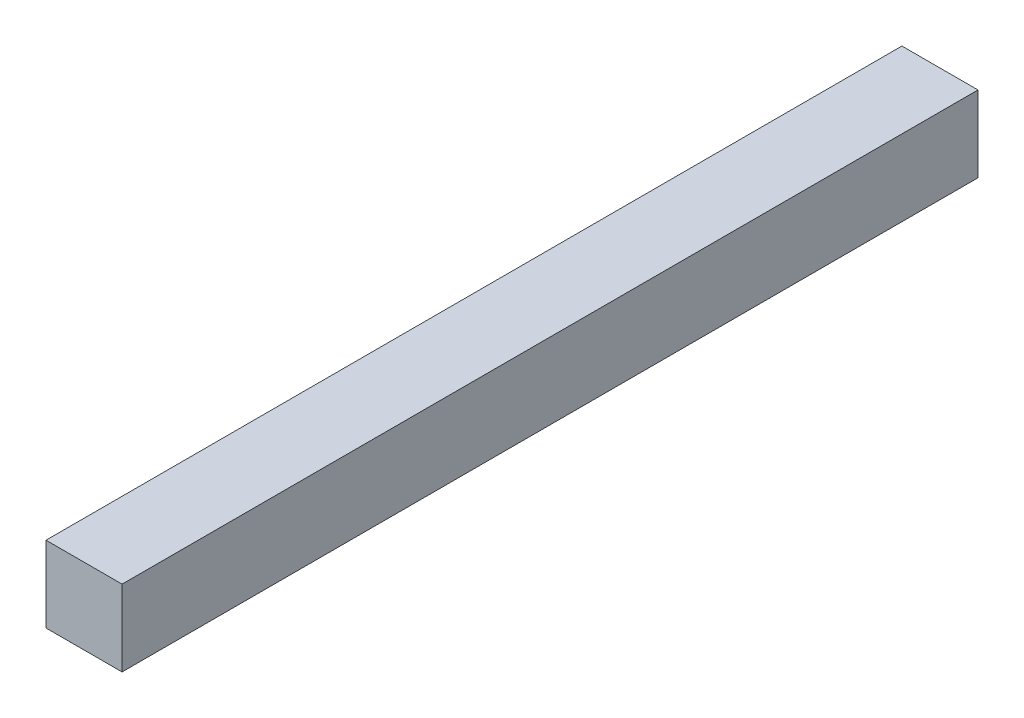
from build123d import *

# Parameters (mm, degrees)
ESQUISSE1_W        = 40
ESQUISSE1_H        = 40
BOSS_EXTRU_1_DEPTH = 450


with BuildPart() as part:
    # Esquisse1 → Boss.-Extru.1 (new body)
    with BuildSketch(Plane.XY):
        with Locations((20, 20)):
            Rectangle(ESQUISSE1_W, ESQUISSE1_H)
    extrude(amount=BOSS_EXTRU_1_DEPTH)


solid = part.part
